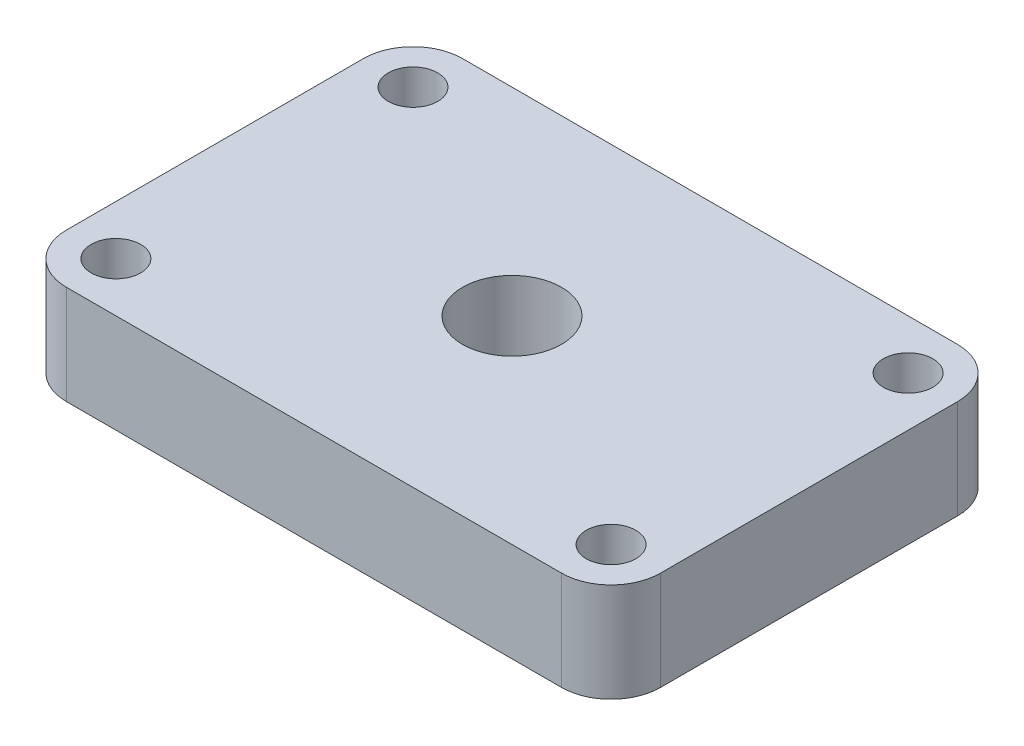
from build123d import *

# Parameters (mm, degrees)
SKETCH1_W           = 60
SKETCH1_H           = 40
SKETCH1_R           = 2.5
SKETCH1_R_2         = 5
BOSS_EXTRUDE1_DEPTH = 10
FILLET1_R           = 5


with BuildPart() as part:
    # Sketch1 → Boss-Extrude1 (new body)
    with BuildSketch(Plane(origin=(0, 0, 0), x_dir=(1, 0, 0), z_dir=(0, 1, 0))):
        with Locations((30, 20)):
            Rectangle(SKETCH1_W, SKETCH1_H)
        with Locations((5, 35)):
            Circle(SKETCH1_R, mode=Mode.SUBTRACT)
        with Locations((55, 35)):
            Circle(SKETCH1_R, mode=Mode.SUBTRACT)
        with Locations((55, 5)):
            Circle(SKETCH1_R, mode=Mode.SUBTRACT)
        with Locations((5, 5)):
            Circle(SKETCH1_R, mode=Mode.SUBTRACT)
        with Locations((30, 20)):
            Circle(SKETCH1_R_2, mode=Mode.SUBTRACT)
    extrude(amount=BOSS_EXTRUDE1_DEPTH)

    # Fillet1
    fillet1_edges = [part.edges().sort_by_distance(p)[0] for p in [
        (0, 5, -40),
        (60, 5, -40),
        (0, 5, 0),
        (60, 5, 0),
    ]]
    fillet(fillet1_edges, radius=FILLET1_R)


solid = part.part
